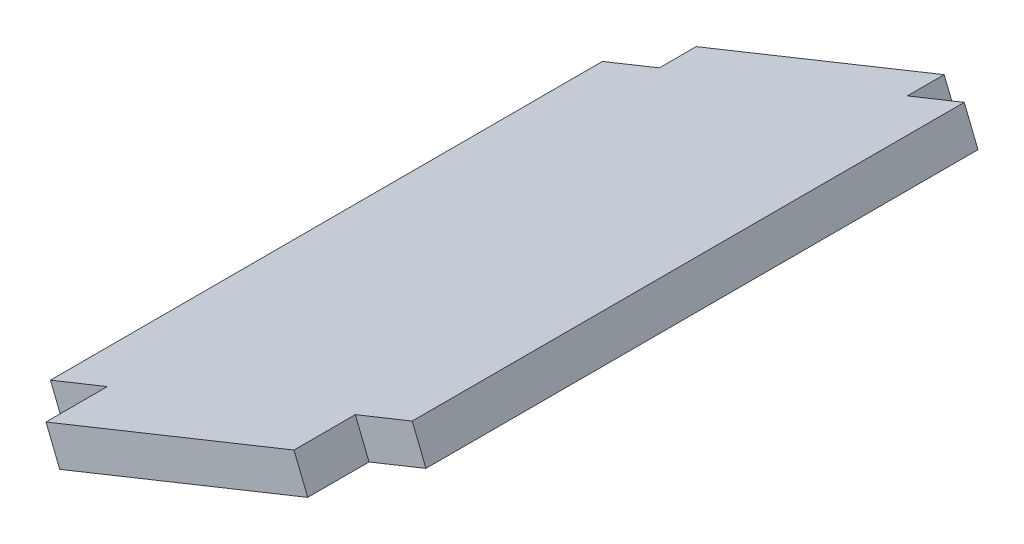
from build123d import *

# Parameters (mm, degrees)
ESTRUSIONE_ESTRUSIONE1_DEPTH      = 48
ESTRUSIONE_ESTRUSIONE1_DEPTH_BACK = 5
SCHIZZO2_W                        = 45
SCHIZZO2_H                        = 3
ESTRUSIONE_ESTRUSIONE2_DEPTH      = 5
CORPO_SPOSTA_COPIA1_START         = 131.104025403
CORPO_SPOSTA_COPIA1_OUTLINE_W     = 3
CORPO_SPOSTA_COPIA1_OUTLINE_H     = 43
CORPO_SPOSTA_COPIA1_DEPTH         = 31.786555516
CORPO_SPOSTA_COPIA1_2_OUTLINE_W   = 3
CORPO_SPOSTA_COPIA1_2_OUTLINE_H   = 5
CORPO_SPOSTA_COPIA1_2_DEPTH       = 5
CORPO_SPOSTA_COPIA1_START_2       = 157.890580919
CORPO_SPOSTA_COPIA1_3_OUTLINE_W   = 3
CORPO_SPOSTA_COPIA1_3_OUTLINE_H   = 5
CORPO_SPOSTA_COPIA1_3_DEPTH       = 5
CORPO_SPOSTA_COPIA1_4_OUTLINE_W   = 3
CORPO_SPOSTA_COPIA1_4_OUTLINE_H   = 45
CORPO_SPOSTA_COPIA1_4_DEPTH       = 31.786555516
CORPO_SPOSTA_COPIA1_START_3       = 136.104025403
CORPO_SPOSTA_COPIA1_5_OUTLINE_W   = 3
CORPO_SPOSTA_COPIA1_5_OUTLINE_H   = 3
CORPO_SPOSTA_COPIA1_5_DEPTH       = 21.786555516


# Read off the part's stored shape, not the designer's step: Corpo-Sposta/copia1
with BuildPart() as part:
    # Schizzo1 → Estrusione-Estrusione1 (new, two sides: drawn at the far end of the back side and taken through both)
    with BuildSketch(Plane.XY.offset(-ESTRUSIONE_ESTRUSIONE1_DEPTH_BACK)):
        Polygon((198.017140331, -69.250735791), (177.803209237, -77.377911869), (178.92231814, -80.161362114), (199.136249234, -72.034186035), align=None)
    extrude(amount=ESTRUSIONE_ESTRUSIONE1_DEPTH + ESTRUSIONE_ESTRUSIONE1_DEPTH_BACK)

    # Schizzo2 → Estrusione-Estrusione2 (add)
    with BuildSketch(Plane(origin=(146.49352536, 58.898918246, 0), x_dir=(0, 0, -1), z_dir=(0.9278167482016688, 0.3730363008562049, 0))):
        with Locations((-22.5, -139.619574027)):
            Rectangle(SCHIZZO2_W, SCHIZZO2_H)
    estrusione_estrusione2 = extrude(amount=ESTRUSIONE_ESTRUSIONE2_DEPTH)

    # Specchia1: Estrusione-Estrusione2 across plane
    add(estrusione_estrusione2.mirror(Plane(origin=(136.386559813, 54.835330207, 0), x_dir=(0, 0, 1), z_dir=(0.9278167482016688, 0.37303630085620504, 0))))

    # Corpo-Sposta/copia1 outline → Corpo-Sposta/copia1 (cut)
    with BuildSketch(Plane(origin=(0, 0, 0), x_dir=(-0.373036300856202, 0.92781674820167, 0), z_dir=(0.92781674820167, 0.373036300856202, 0)).offset(CORPO_SPOSTA_COPIA1_START)):
        with Locations((-139.619574027, 26.5)):
            Rectangle(CORPO_SPOSTA_COPIA1_OUTLINE_W, CORPO_SPOSTA_COPIA1_OUTLINE_H)
    extrude(amount=CORPO_SPOSTA_COPIA1_DEPTH, mode=Mode.SUBTRACT)

    # Corpo-Sposta_copia1 2 outline → Corpo-Sposta_copia1 2 (cut)
    with BuildSketch(Plane(origin=(0, 0, 0), x_dir=(-0.373036300856202, 0.92781674820167, 0), z_dir=(0.92781674820167, 0.373036300856202, 0)).offset(CORPO_SPOSTA_COPIA1_START)):
        with Locations((-139.619574027, 2.5)):
            Rectangle(CORPO_SPOSTA_COPIA1_2_OUTLINE_W, CORPO_SPOSTA_COPIA1_2_OUTLINE_H)
    extrude(amount=CORPO_SPOSTA_COPIA1_2_DEPTH, mode=Mode.SUBTRACT)

    # Corpo-Sposta_copia1 3 outline → Corpo-Sposta_copia1 3 (cut)
    with BuildSketch(Plane(origin=(0, 0, 0), x_dir=(-0.373036300856202, 0.92781674820167, 0), z_dir=(0.92781674820167, 0.373036300856202, 0)).offset(CORPO_SPOSTA_COPIA1_START_2)):
        with Locations((-139.619574027, 2.5)):
            Rectangle(CORPO_SPOSTA_COPIA1_3_OUTLINE_W, CORPO_SPOSTA_COPIA1_3_OUTLINE_H)
    extrude(amount=CORPO_SPOSTA_COPIA1_3_DEPTH, mode=Mode.SUBTRACT)

    # Corpo-Sposta_copia1 4 outline → Corpo-Sposta_copia1 4 (add)
    with BuildSketch(Plane(origin=(0, 0, 0), x_dir=(-0.373036300856202, 0.92781674820167, 0), z_dir=(0.92781674820167, 0.373036300856202, 0)).offset(CORPO_SPOSTA_COPIA1_START)):
        with Locations((-139.619574027, -22.5)):
            Rectangle(CORPO_SPOSTA_COPIA1_4_OUTLINE_W, CORPO_SPOSTA_COPIA1_4_OUTLINE_H)
    extrude(amount=CORPO_SPOSTA_COPIA1_4_DEPTH)

    # Corpo-Sposta_copia1 5 outline → Corpo-Sposta_copia1 5 (add)
    with BuildSketch(Plane(origin=(0, 0, 0), x_dir=(-0.373036300856202, 0.92781674820167, 0), z_dir=(0.92781674820167, 0.373036300856202, 0)).offset(CORPO_SPOSTA_COPIA1_START_3)):
        with Locations((-139.619574027, -46.5)):
            Rectangle(CORPO_SPOSTA_COPIA1_5_OUTLINE_W, CORPO_SPOSTA_COPIA1_5_OUTLINE_H)
    extrude(amount=CORPO_SPOSTA_COPIA1_5_DEPTH)


solid = part.part
